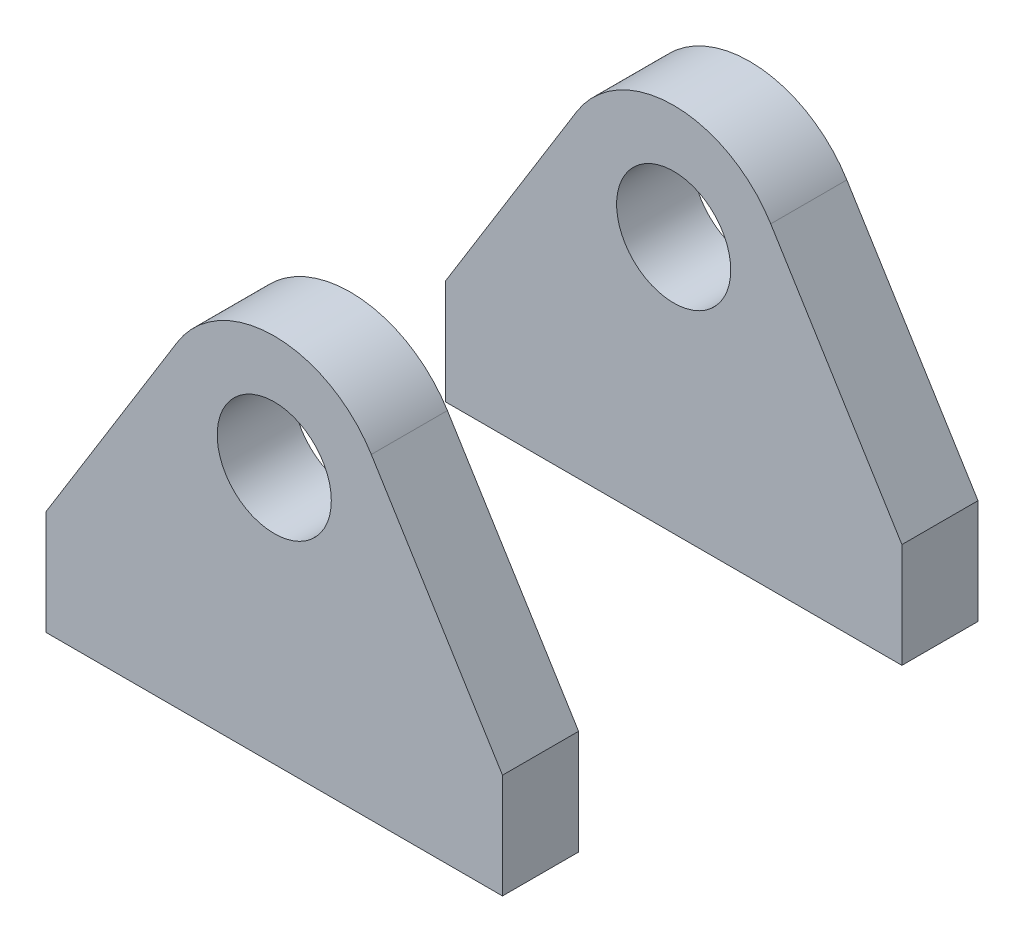
from build123d import *

# Parameters (mm, degrees)
SKETCH1_R           = 9.525
SKETCH1_W           = 76.2
SKETCH1_H           = 17.4625
BOSS_EXTRUDE1_DEPTH = 12.7
LPATTERN1_COUNT     = 2
LPATTERN1_PITCH     = 33.3375
SCALE1_START        = -33.3375
SCALE1_DEPTH        = 46.0375
SCALE1_START_2      = -23.8125
SCALE1_2_DEPTH      = 26.9875
SCALE1_3_DEPTH      = 3.175
SCALE1_START_3      = 9.525
SCALE1_4_DEPTH      = 3.175
SCALE1_START_4      = -30.1625
SCALE1_5_DEPTH      = 6.35
SCALE1_START_5      = 3.175
SCALE1_6_DEPTH      = 6.35


# Read off the part's stored shape, not the designer's step: Scale1
with BuildPart() as part:
    # Sketch1 → Boss-Extrude1 (new body)
    # profile 1 of 2: a face of its own
    with BuildSketch(Plane.XY):
        with BuildLine():
            ThreePointArc((-16.203400299, 35.417600449), (0, 44.45), (16.203400299, 35.417600449))
            Line((16.203400299, 35.417600449), (38.1, 0))
            Line((38.1, 0), (-38.1, 0))
            Line((-38.1, 0), (-16.203400299, 35.417600449))
        make_face()
        with Locations((0, 25.4)):
            Circle(SKETCH1_R, mode=Mode.SUBTRACT)
    # profile 2 of 2: a face of its own
    with BuildSketch(Plane.XY):
        with Locations((0, -8.73125)):
            Rectangle(SKETCH1_W, SKETCH1_H)
    extrude(amount=BOSS_EXTRUDE1_DEPTH)


with BuildPart() as lpattern1_1:
    # LPattern1: pattern copy
    add(part.part.moved(Location(Vector(0, 0, -1) * (1 * LPATTERN1_PITCH))))


with BuildPart() as scale1_tool:
    # Scale1 outline → Scale1 (new body)
    # profile 1 of 2: a face of its own
    with BuildSketch(Plane.XY.offset(SCALE1_START)):
        with BuildLine():
            ThreePointArc((16.203400299, 35.417600449), (0, 44.45), (-16.203400299, 35.417600449))
            Line((-16.203400299, 35.417600449), (-38.1, 0))
            Line((-38.1, 0), (-38.1, -17.4625))
            Line((-38.1, -17.4625), (38.1, -17.4625))
            Line((38.1, -17.4625), (38.1, 0))
            Line((38.1, 0), (16.203400299, 35.417600449))
        make_face()
        with BuildLine():
            Line((-19.05, 2.946121023), (-8.182474067, 20.524269988))
            ThreePointArc((-8.182474067, 20.524269988), (0, 34.925), (8.182474067, 20.524269988))
            Line((8.182474067, 20.524269988), (19.05, 2.946121023))
            Line((19.05, 2.946121023), (19.05, -5.785128977))
            Line((19.05, -5.785128977), (-19.05, -5.785128977))
            Line((-19.05, -5.785128977), (-19.05, 2.946121023))
        make_face(mode=Mode.SUBTRACT)
    # profile 2 of 2: a face of its own
    with BuildSketch(Plane.XY.offset(SCALE1_START)):
        with BuildLine():
            ThreePointArc((4.555482234, 17.035001099), (0, 15.875), (-4.555482234, 17.035001099))
            ThreePointArc((-4.555482234, 17.035001099), (0, 10.883621023), (4.555482234, 17.035001099))
        make_face()
    extrude(amount=SCALE1_DEPTH)


with BuildPart() as part_1:
    add(part.part)

    # Scale1: cut by scale1_tool
    add(scale1_tool.part, mode=Mode.SUBTRACT)


with BuildPart() as lpattern1_1_1:
    add(lpattern1_1.part)

    # Scale1: cut by scale1_tool
    add(scale1_tool.part, mode=Mode.SUBTRACT)


with BuildPart() as scale1_2_tool:
    # Scale1 2 outline → Scale1 2 (new body)
    with BuildSketch(Plane.XY.offset(SCALE1_START_2)):
        with BuildLine():
            ThreePointArc((-4.555482234, 17.035001099), (-6.603607501, 18.535745272), (-8.182474067, 20.524269988))
            Line((-8.182474067, 20.524269988), (-19.05, 2.946121023))
            Line((-19.05, 2.946121023), (-19.05, -5.785128977))
            Line((-19.05, -5.785128977), (19.05, -5.785128977))
            Line((19.05, -5.785128977), (19.05, 2.946121023))
            Line((19.05, 2.946121023), (8.182474067, 20.524269988))
            ThreePointArc((8.182474067, 20.524269988), (6.603607501, 18.535745272), (4.555482234, 17.035001099))
            ThreePointArc((4.555482234, 17.035001099), (0, 10.883621023), (-4.555482234, 17.035001099))
        make_face()
    extrude(amount=SCALE1_2_DEPTH)


with BuildPart() as part_2:
    add(part_1.part)

    # Scale1 2: cut by scale1_2_tool
    add(scale1_2_tool.part, mode=Mode.SUBTRACT)

    # Scale1 4 outline → Scale1 4 (cut)
    with BuildSketch(Plane.XY.offset(SCALE1_START_3)):
        with BuildLine():
            ThreePointArc((-4.555482234, 17.035001099), (-6.603607501, 18.535745272), (-8.182474067, 20.524269988))
            Line((-8.182474067, 20.524269988), (-19.05, 2.946121023))
            Line((-19.05, 2.946121023), (-19.05, -5.785128977))
            Line((-19.05, -5.785128977), (19.05, -5.785128977))
            Line((19.05, -5.785128977), (19.05, 2.946121023))
            Line((19.05, 2.946121023), (8.182474067, 20.524269988))
            ThreePointArc((8.182474067, 20.524269988), (6.603607501, 18.535745272), (4.555482234, 17.035001099))
            ThreePointArc((4.555482234, 17.035001099), (0, 10.883621023), (-4.555482234, 17.035001099))
        make_face()
    extrude(amount=SCALE1_4_DEPTH, mode=Mode.SUBTRACT)


with BuildPart() as lpattern1_1_2:
    add(lpattern1_1_1.part)

    # Scale1 2: cut by scale1_2_tool
    add(scale1_2_tool.part, mode=Mode.SUBTRACT)

    # Scale1 3 outline → Scale1 3 (cut)
    with BuildSketch(Plane.XY.offset(SCALE1_START)):
        with BuildLine():
            ThreePointArc((-4.555482234, 17.035001099), (-6.603607501, 18.535745272), (-8.182474067, 20.524269988))
            Line((-8.182474067, 20.524269988), (-19.05, 2.946121023))
            Line((-19.05, 2.946121023), (-19.05, -5.785128977))
            Line((-19.05, -5.785128977), (19.05, -5.785128977))
            Line((19.05, -5.785128977), (19.05, 2.946121023))
            Line((19.05, 2.946121023), (8.182474067, 20.524269988))
            ThreePointArc((8.182474067, 20.524269988), (6.603607501, 18.535745272), (4.555482234, 17.035001099))
            ThreePointArc((4.555482234, 17.035001099), (0, 10.883621023), (-4.555482234, 17.035001099))
        make_face()
    extrude(amount=SCALE1_3_DEPTH, mode=Mode.SUBTRACT)


    add(part_2.part)  # Scale1 5 merges part
    # Scale1 5 outline → Scale1 5 (add)
    with BuildSketch(Plane.XY.offset(SCALE1_START_4)):
        with BuildLine():
            ThreePointArc((8.10170015, 20.654921247), (0, 25.171121023), (-8.10170015, 20.654921247))
            Line((-8.10170015, 20.654921247), (-8.182474067, 20.524269988))
            ThreePointArc((-8.182474067, 20.524269988), (-6.603607501, 18.535745272), (-4.555482234, 17.035001099))
            ThreePointArc((-4.555482234, 17.035001099), (0, 20.408621023), (4.555482234, 17.035001099))
            ThreePointArc((4.555482234, 17.035001099), (6.603607501, 18.535745272), (8.182474067, 20.524269988))
            Line((8.182474067, 20.524269988), (8.10170015, 20.654921247))
        make_face()
    extrude(amount=SCALE1_5_DEPTH)

    # Scale1 6 outline → Scale1 6 (add)
    with BuildSketch(Plane.XY.offset(SCALE1_START_5)):
        with BuildLine():
            ThreePointArc((8.10170015, 20.654921247), (0, 25.171121023), (-8.10170015, 20.654921247))
            Line((-8.10170015, 20.654921247), (-8.182474067, 20.524269988))
            ThreePointArc((-8.182474067, 20.524269988), (-6.603607501, 18.535745272), (-4.555482234, 17.035001099))
            ThreePointArc((-4.555482234, 17.035001099), (0, 20.408621023), (4.555482234, 17.035001099))
            ThreePointArc((4.555482234, 17.035001099), (6.603607501, 18.535745272), (8.182474067, 20.524269988))
            Line((8.182474067, 20.524269988), (8.10170015, 20.654921247))
        make_face()
    extrude(amount=SCALE1_6_DEPTH)


solid = lpattern1_1_2.part
